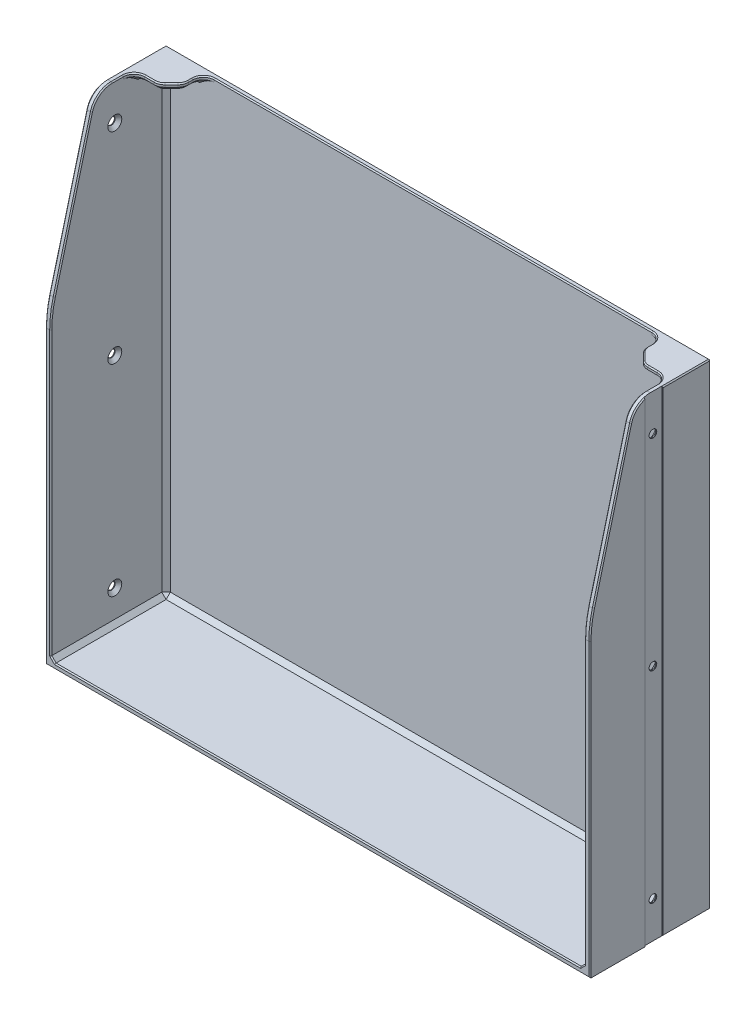
from build123d import *

# Parameters (mm, degrees)
SKETCH1_W                                      = 255
SKETCH1_H                                      = 223
BOSS_EXTRUDE1_DEPTH                            = 2.5
SKETCH2_W                                      = 2.5
SKETCH2_H                                      = 223
SKETCH2_W_2                                    = 250
SKETCH2_H_2                                    = 2.5
BOSS_EXTRUDE2_DEPTH                            = 54
FRONT_TAPER_DEPTH                              = 178.776545135
FRONT_TAPER_DEPTH_BACK                         = 178.776545135
HOLD_IN_TAB_DEPTH                              = 3
SKETCH6_W                                      = 8.4
SKETCH6_H                                      = 227.2
MOUNTING_POCKET_DEPTH                          = 284.052115343
CSK_FOR_M3_FLAT_HEAD_MACHINE_SCREW1_AT_2_COUNT = 2
CSK_FOR_M3_FLAT_HEAD_MACHINE_SCREW1_AT_2_PITCH = 94.285714286
CSK_FOR_M3_FLAT_HEAD_MACHINE_SCREW1_AT_3_COUNT = 2
CSK_FOR_M3_FLAT_HEAD_MACHINE_SCREW1_AT_3_PITCH = 188.571428571
FILLET2_R                                      = 5
FILLET3_R                                      = 10
FILLET4_R                                      = 50
INSERT_CHAMS_SIZE                              = 1.5
INSIDE_CHAMS_SIZE                              = 2
DEBURS_SIZE                                    = 0.5


with BuildPart() as part:
    # Sketch1 → Boss-Extrude1 (new body)
    with BuildSketch(Plane.XY):
        Rectangle(SKETCH1_W, SKETCH1_H)
    extrude(amount=-BOSS_EXTRUDE1_DEPTH)

    # Sketch2 → Boss-Extrude2 (add)
    with BuildSketch(Plane.XY):
        with Locations((-126.25, 0)):
            Rectangle(SKETCH2_W, SKETCH2_H)
        with Locations((0, -110.25)):
            Rectangle(SKETCH2_W_2, SKETCH2_H_2)
        with Locations((126.25, 0)):
            Rectangle(SKETCH2_W, SKETCH2_H)
    extrude(amount=BOSS_EXTRUDE2_DEPTH)

    # Sketch5 → Front Taper (cut, two sides: drawn at the far end of the back side and taken through both)
    with BuildSketch(Plane(origin=(0, 0, 0), x_dir=(0, 0, -1), z_dir=(1, 0, 0)).offset(-FRONT_TAPER_DEPTH_BACK)):
        Polygon((-54, 31.5), (-33, 111.5), (-54, 111.5), align=None)
    extrude(amount=FRONT_TAPER_DEPTH + FRONT_TAPER_DEPTH_BACK, mode=Mode.SUBTRACT)

    # Sketch10 → Hold In Tab (add)
    with BuildSketch(Plane(origin=(0, 111.5, 0), x_dir=(1, 0, 0), z_dir=(0, 1, 0))):
        Polygon((127.5, -15), (113.5, -15), (107.5, -9), (107.5, 2.5), (127.5, 2.5), align=None)
    hold_in_tab = extrude(amount=-HOLD_IN_TAB_DEPTH)

    # Hold Tabs: Hold In Tab across plane
    add(hold_in_tab.mirror(Plane(origin=(0, 0, 0), x_dir=(0, 0, 1), z_dir=(1, 0, 0))))

    # Sketch6 → Mounting Pocket (cut, through all)
    with BuildSketch(Plane.ZY.offset(-127)):
        with Locations((24, 1.35)):
            Rectangle(SKETCH6_W, SKETCH6_H)
    mounting_pocket = extrude(amount=-MOUNTING_POCKET_DEPTH, mode=Mode.SUBTRACT)

    # Mounting Pockets: Mounting Pocket across plane
    add(mounting_pocket.mirror(Plane(origin=(0, 0, 0), x_dir=(0, 0, 1), z_dir=(1, 0, 0))), mode=Mode.SUBTRACT)

    # Sketch9 → CSK for M3 Flat Head Machine Screw1 (revolve, cut)
    with BuildSketch(Plane(origin=(125, -94.285714286, 24), x_dir=(0, 0, 1), z_dir=(0, 1, 0))):
        Polygon((0, 0), (0, 2), (1.8, 2), (1.7, 1.9), (1.7, 1.55), (3.25, 0), align=None)
    csk_for_m3_flat_head_machine_screw1 = revolve(axis=Axis((118.65, -94.285714286, 24), (1, 0, 0)), mode=Mode.SUBTRACT)

    # CSK for M3 Flat Head Machine Screw1 at 2: CSK for M3 Flat Head Machine Screw1 ×2
    with Locations(*[(0, i * CSK_FOR_M3_FLAT_HEAD_MACHINE_SCREW1_AT_2_PITCH, 0) for i in range(1, CSK_FOR_M3_FLAT_HEAD_MACHINE_SCREW1_AT_2_COUNT)]):
        add(csk_for_m3_flat_head_machine_screw1, mode=Mode.SUBTRACT)

    # CSK for M3 Flat Head Machine Screw1 at 3: CSK for M3 Flat Head Machine Screw1 ×2
    with Locations(*[(0, i * CSK_FOR_M3_FLAT_HEAD_MACHINE_SCREW1_AT_3_PITCH, 0) for i in range(1, CSK_FOR_M3_FLAT_HEAD_MACHINE_SCREW1_AT_3_COUNT)]):
        add(csk_for_m3_flat_head_machine_screw1, mode=Mode.SUBTRACT)

    # Mounting Screw Holes: CSK for M3 Flat Head Machine Screw1 across plane
    add(csk_for_m3_flat_head_machine_screw1.mirror(Plane(origin=(0, 0, 0), x_dir=(0, 0, 1), z_dir=(1, 0, 0))), mode=Mode.SUBTRACT)

    # Mounting Screw Holes copy 1 sketch → Mounting Screw Holes copy 1 (revolve, cut)
    with BuildSketch(Plane(origin=(-125, 0, 24), x_dir=(0, 0, 1), z_dir=(0, 1, 0))):
        Polygon((0, 0), (0, -2), (1.8, -2), (1.7, -1.9), (1.7, -1.55), (3.25, 0), align=None)
    revolve(axis=Axis((-118.65, 0, 24), (1, 0, 0)), mode=Mode.SUBTRACT)

    # Mounting Screw Holes copy 2 sketch → Mounting Screw Holes copy 2 (revolve, cut)
    with BuildSketch(Plane(origin=(-125, 94.285714286, 24), x_dir=(0, 0, 1), z_dir=(0, 1, 0))):
        Polygon((0, 0), (0, -2), (1.8, -2), (1.7, -1.9), (1.7, -1.55), (3.25, 0), align=None)
    revolve(axis=Axis((-118.65, 94.285714286, 24), (1, 0, 0)), mode=Mode.SUBTRACT)

    # Fillet2
    fillet2_edges = [part.edges().sort_by_distance(p)[0] for p in [
        (125, 110, 15),
        (107.5, 110, 0),
        (107.5, 110, 9),
        (113.5, 110, 15),
        (-125, 110, 15),
        (-107.5, 110, 0),
        (-107.5, 110, 9),
        (-113.5, 110, 15),
    ]]
    fillet(fillet2_edges, radius=FILLET2_R)

    # Fillet3
    fillet3_edges = [part.edges().sort_by_distance(p)[0] for p in [
        (-126.25, 111.5, 33),
        (126.25, 111.5, 33),
    ]]
    fillet(fillet3_edges, radius=FILLET3_R)

    # Fillet4
    fillet4_edges = [part.edges().sort_by_distance(p)[0] for p in [
        (126.25, 31.5, 54),
        (-126.25, 31.5, 54),
    ]]
    fillet(fillet4_edges, radius=FILLET4_R)

    # Insert Chams
    # the kernel refuses this chamfer: 1.5 mm, written as the material it takes off along each edge
    with BuildSketch(Plane(origin=(-112.035533906, 108.5, 13.535533906), x_dir=(0.01944252080601449, 0.9996219169112968, 0.01944252080601441), z_dir=(0.7071067811865461, 0, -0.707106781186549)), Plane(origin=(112.035533906, 108.5, 13.535533906), x_dir=(0.706839436070675, -0.02749587661058209, -0.7068394360706722), z_dir=(-0.7071067811865461, 0, -0.707106781186549))) as insert_chams_piece_1:
        Polygon((INSERT_CHAMS_SIZE * 0.999621916911, -INSERT_CHAMS_SIZE * 0.0274958766106), (-INSERT_CHAMS_SIZE * 0.0274958766106, -INSERT_CHAMS_SIZE * 0.999621916911), (0, 0), align=None)
    extrude(amount=4.343145751, mode=Mode.SUBTRACT)
    with BuildSketch(Plane(origin=(-107.5, 108.5, 6.928932188), x_dir=(0.027495876610582292, 0.9996219169112969, 0), z_dir=(0, 0, -1)), Plane(origin=(107.5, 108.5, 6.928932188), x_dir=(0.9996219169112969, -0.027495876610582292, 0), z_dir=(0, 0, -1))) as insert_chams_piece_2:
        Polygon((INSERT_CHAMS_SIZE * 0.999621916911, -INSERT_CHAMS_SIZE * 0.0274958766106), (-INSERT_CHAMS_SIZE * 0.0274958766106, -INSERT_CHAMS_SIZE * 0.999621916911), (0, 0), align=None)
    extrude(amount=1.928932188, mode=Mode.SUBTRACT)
    with BuildSketch(Plane(origin=(-120, 108.5, 15), x_dir=(0, 0.9996219169112968, 0.027495876610586893), z_dir=(1, 0, 0)), Plane(origin=(120, 108.5, 15), x_dir=(0, -0.027495876610582164, -0.9996219169112969), z_dir=(-1, 0, 0))) as insert_chams_piece_3:
        Polygon((INSERT_CHAMS_SIZE * 0.999621916911, -INSERT_CHAMS_SIZE * 0.0274958766106), (-INSERT_CHAMS_SIZE * 0.0274958766106, -INSERT_CHAMS_SIZE * 0.999621916911), (0, 0), align=None)
    extrude(amount=4.428932188, mode=Mode.SUBTRACT)
    with BuildSketch(Plane(origin=(-115.571067812, 108.5, 10), x_dir=(0, 0, 1), z_dir=(-1, 0, 0))) as insert_chams_piece_4:
        Polygon((5, INSERT_CHAMS_SIZE), (5 - INSERT_CHAMS_SIZE, 0), (5, 0), align=None)
    revolve(axis=Axis((-115.571067812, 108.5, 10), (0, 1, 0)), revolution_arc=45, mode=Mode.SUBTRACT)
    with BuildSketch(Plane(origin=(-112.5, 108.5, 6.928932188), x_dir=(1, 0, 0), z_dir=(0, 0, -1))) as insert_chams_piece_5:
        Polygon((5, -INSERT_CHAMS_SIZE), (5 - INSERT_CHAMS_SIZE, 0), (5, 0), align=None)
    revolve(axis=Axis((-112.5, 108.5, 6.928932188), (0, -1, 0)), revolution_arc=45, mode=Mode.SUBTRACT)
    with BuildSketch(Plane(origin=(115.571067812, 108.5, 10), x_dir=(0, 0, 1), z_dir=(1, 0, 0))) as insert_chams_piece_6:
        Polygon((5 - INSERT_CHAMS_SIZE, 0), (5, -INSERT_CHAMS_SIZE), (5, 0), align=None)
    revolve(axis=Axis((115.571067812, 108.5, 10), (0, -1, 0)), revolution_arc=45, mode=Mode.SUBTRACT)
    with BuildSketch(Plane(origin=(112.5, 108.5, 6.928932188), x_dir=(-0.7071067811865478, 0, 0.7071067811865472), z_dir=(0.7071067811865472, 0, 0.7071067811865478))) as insert_chams_piece_7:
        Polygon((5 - INSERT_CHAMS_SIZE, 0), (5, -INSERT_CHAMS_SIZE), (5, 0), align=None)
    revolve(axis=Axis((112.5, 108.5, 6.928932188), (0, -1, 0)), revolution_arc=45, mode=Mode.SUBTRACT)
    with BuildSketch(Plane(origin=(-120, 108.5, 20), x_dir=(-0.7166461305573681, 0, 0.6974369674437623), z_dir=(0.6974369674437623, 0, 0.7166461305573681))) as insert_chams_piece_8_section:
        Polygon((5, -INSERT_CHAMS_SIZE), (5 + INSERT_CHAMS_SIZE, 0), (5, 0), align=None)
    insert_chams_piece_8 = revolve(axis=Axis((-120, 108.5, 20), (0, -1, 0)), revolution_arc=134.221731534, mode=Mode.PRIVATE)
    insert_chams_piece_8 = split(insert_chams_piece_8, bisect_by=Plane(origin=(-125, 109.058393583, 16.326998509), z_dir=(1, 0, 0)), keep=Keep.TOP, mode=Mode.PRIVATE)
    add(insert_chams_piece_8, mode=Mode.SUBTRACT)
    with BuildSketch(Plane(origin=(-102.5, 108.5, 5), x_dir=(0.6974369674437586, 0, -0.7166461305573718), z_dir=(0.7166461305573718, 0, 0.6974369674437586))) as insert_chams_piece_9_section:
        Polygon((5, INSERT_CHAMS_SIZE), (5 + INSERT_CHAMS_SIZE, 0), (5, 0), align=None)
    insert_chams_piece_9 = revolve(axis=Axis((-102.5, 108.5, 5), (0, 1, 0)), revolution_arc=134.221731534, mode=Mode.PRIVATE)
    insert_chams_piece_9 = split(insert_chams_piece_9, bisect_by=Plane(origin=(-106.173001491, 109.058393583, 0), z_dir=(0, 0, 1)), keep=Keep.TOP, mode=Mode.PRIVATE)
    add(insert_chams_piece_9, mode=Mode.SUBTRACT)
    with BuildSketch(Plane(origin=(102.5, 108.5, 5), x_dir=(-0.6974369674437586, 0, -0.7166461305573718), z_dir=(-0.7166461305573718, 0, 0.6974369674437586))) as insert_chams_piece_10_section:
        Polygon((5 + INSERT_CHAMS_SIZE, 0), (5, -INSERT_CHAMS_SIZE), (5, 0), align=None)
    insert_chams_piece_10 = revolve(axis=Axis((102.5, 108.5, 5), (0, -1, 0)), revolution_arc=134.221731534, mode=Mode.PRIVATE)
    insert_chams_piece_10 = split(insert_chams_piece_10, bisect_by=Plane(origin=(106.173001491, 109.058393583, 0), z_dir=(0, 0, 1)), keep=Keep.TOP, mode=Mode.PRIVATE)
    add(insert_chams_piece_10, mode=Mode.SUBTRACT)
    with BuildSketch(Plane(origin=(120, 108.5, 20), x_dir=(0.716646130557371, 0, 0.6974369674437595), z_dir=(-0.6974369674437595, 0, 0.716646130557371))) as insert_chams_piece_11_section:
        Polygon((5, INSERT_CHAMS_SIZE), (5 + INSERT_CHAMS_SIZE, 0), (5, 0), align=None)
    insert_chams_piece_11 = revolve(axis=Axis((120, 108.5, 20), (0, 1, 0)), revolution_arc=134.221731534, mode=Mode.PRIVATE)
    insert_chams_piece_11 = split(insert_chams_piece_11, bisect_by=Plane(origin=(125, 109.058393583, 16.326998509), z_dir=(-1, 0, 0)), keep=Keep.TOP, mode=Mode.PRIVATE)
    add(insert_chams_piece_11, mode=Mode.SUBTRACT)

    # Inside Chams
    inside_chams_edges = [part.edges().sort_by_distance(p)[0] for p in [
        (-125, -109, 27),
        (125, -109, 27),
        (0, -109, 0),
        (-125, 108.5, 7.923344034),
        (-115.826655966, 108.5, 0),
        (125, 108.5, 7.923344034),
        (125, -0.25, 0),
        (115.826655966, 108.5, 0),
        (-125, -0.25, 0),
    ]]
    chamfer(inside_chams_edges, length=INSIDE_CHAMS_SIZE)

    # Deburs
    deburs_edges = [part.edges().sort_by_distance(p)[0] for p in [
        (-127.5, 0, -2.5),
        (0, -111.5, -2.5),
        (0, -111.5, 54),
        (-110.5, 111.5, 12),
        (-117.785533906, 111.5, 15),
        (-107.5, 111.5, 5.964466094),
        (0, 111.5, 0),
        (107.5, 111.5, 5.964466094),
        (110.5, 111.5, 12),
        (117.785533906, 111.5, 15),
        (113.65765065, 111.5, 14.619397663),
        (107.880602337, 111.5, 8.84234935),
        (-113.65765065, 111.5, 14.619397663),
        (-107.880602337, 111.5, 8.84234935),
        (-123.535533906, 111.5, 16.464466094),
        (-106.035533906, 111.5, 1.464466094),
        (106.035533906, 111.5, 1.464466094),
        (123.535533906, 111.5, 16.464466094),
        (125, 111.5, 22.64310388),
        (-125, 111.5, 22.64310388),
        (-125, 109.418011519, 31.393997341),
        (-127.5, 108.431990614, 32.493669596),
        (127.5, 108.431990614, 32.493669596),
        (125, 109.418011519, 31.393997341),
        (-125, 70.890351082, 43.660032841),
        (-127.5, 70.890351082, 43.660032841),
        (-125, -40.97659277, 54),
        (-125, 31.446915496, 53.588695352),
        (-127.5, -43.22659277, 54),
        (127.5, -43.22659277, 54),
        (125, -40.97659277, 54),
        (-127.5, 31.446915496, 53.588695352),
        (127.5, 70.890351082, 43.660032841),
        (125, 70.890351082, 43.660032841),
        (127.5, 31.446915496, 53.588695352),
        (125, 31.446915496, 53.588695352),
        (0, -109, 54),
        (-124, -108, 54),
        (124, -108, 54),
        (127.5, 0, -2.5),
        (127.5, -111.5, 8.65),
        (-127.5, -111.5, 8.65),
        (-127.5, 111.5, 8.65),
        (127.5, 111.5, 8.65),
        (0, 111.5, -2.5),
    ]]
    chamfer(deburs_edges, length=DEBURS_SIZE)


solid = part.part
